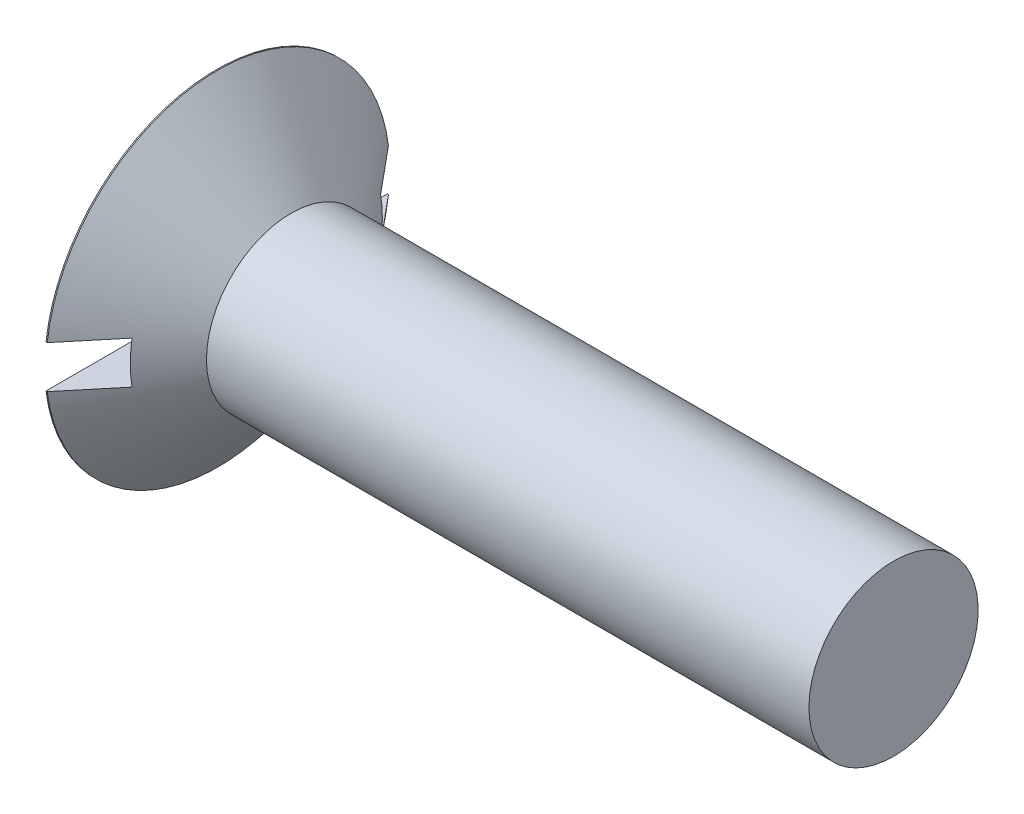
from build123d import *

# Parameters (mm, degrees)
SKETCH2_W         = 19.3548
SKETCH2_H         = 2.3876
SLOT_DEPTH        = 2.2352
CIRPATTERN1_COUNT = 2
CIRPATTERN1_ANGLE = 90


with BuildPart() as part:
    # BodySke → Base-Revolve (revolve)
    with BuildSketch(Plane.XY):
        Polygon((0, 0), (0, 9.6774), (0.066909223, 9.6774), (4.191, 4.7625), (38.1, 4.7625), (38.1, 0), align=None)
    revolve(axis=Axis((-6.35, 0, 0), (1, 0, 0)))

    # Sketch2 → Slot (cut)
    with BuildSketch(Plane.ZY):
        Rectangle(SKETCH2_W, SKETCH2_H)
    extrude(amount=-SLOT_DEPTH, mode=Mode.SUBTRACT)

    # Sketch3 → Cross section 0
    with BuildSketch(Plane.ZY):
        with BuildLine():
            Line((-1.0922, 6.6421), (1.0922, 6.6421))
            Line((1.0922, 6.6421), (1.0922, -6.6421))
            Line((1.0922, -6.6421), (-1.0922, -6.6421))
            Line((-1.0922, -6.6421), (-1.0922, 6.6421))
        make_face()
    # Sketch4 → Cross section 1
    with BuildSketch(Plane.ZY.offset(-7.9756)):
        with BuildLine():
            Line((-0.5461, 0.5461), (0.5461, 0.5461))
            Line((0.5461, 0.5461), (0.5461, -0.5461))
            Line((0.5461, -0.5461), (-0.5461, -0.5461))
            Line((-0.5461, -0.5461), (-0.5461, 0.5461))
        make_face()
    cross = loft(mode=Mode.SUBTRACT)

    # CirPattern1: Cross ×2 about axis
    cirpattern1_axis = Axis((-6.35, 0, 0), (1, 0, 0))
    for i in range(1, CIRPATTERN1_COUNT):
        add(cross.rotate(cirpattern1_axis, i * CIRPATTERN1_ANGLE / (CIRPATTERN1_COUNT - 1)), mode=Mode.SUBTRACT)


solid = part.part
